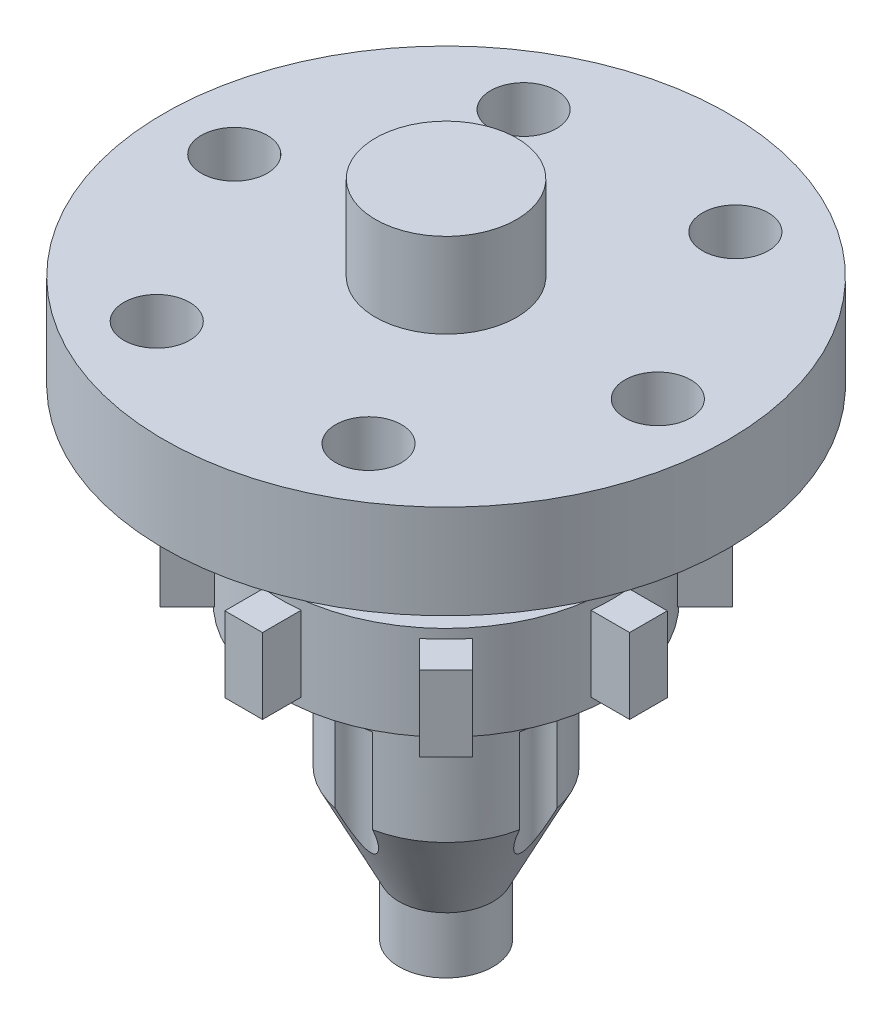
from build123d import *

# Parameters (mm, degrees)
HOLE2_START        = 255
HOLE2_OUTLINE_R    = 17.5
HOLE2_DEPTH        = 50
CIRPATTERN1_COUNT  = 6
RIB2_START         = -20
RIB2_DEPTH         = 40
CIRPATTERN2_COUNT  = 8
SKETCH13_R         = 10
CUT_EXTRUDE1_DEPTH = 125
CIRPATTERN3_COUNT  = 4


# Read off the part's stored shape, not the designer's step: Hole2, Rib2
with BuildPart() as part:
    # Sketch1 → Revolve1 (revolve)
    with BuildSketch(Plane.XY):
        Polygon((0, 0), (0, 350), (37.5, 350), (37.5, 305), (150, 305), (150, 255), (60, 255), (60, 205), (87.5, 205), (87.5, 155), (50, 155), (50, 80), (25, 30), (25, 0), align=None)
    revolve(axis=Axis((0, 0, 0), (0, 1, 0)))

    # Hole2 outline → Hole2 (cut)
    with BuildSketch(Plane(origin=(0, 0, 0), x_dir=(1, 0, 0), z_dir=(0, 1, 0)).offset(HOLE2_START)):
        with Locations((112.5, 0)):
            Circle(HOLE2_OUTLINE_R)
    hole2 = extrude(amount=HOLE2_DEPTH, mode=Mode.SUBTRACT)

    # CirPattern1: Hole2 ×6 about axis
    cirpattern1_axis = Axis((0, 0, 0), (0, 1, 0))
    for i in range(1, CIRPATTERN1_COUNT):
        add(hole2.rotate(cirpattern1_axis, i * 360 / CIRPATTERN1_COUNT), mode=Mode.SUBTRACT)

    # Rib2 outline → Rib2 (add)
    with BuildSketch(Plane(origin=(0, 180, 0), x_dir=(-1, 0, 0), z_dir=(0, -1, 0)).offset(RIB2_START)):
        with BuildLine():
            ThreePointArc((-10, 86.926693254), (0, 87.5), (10, 86.926693254))
            Line((10, 86.926693254), (10, 107.5))
            Line((10, 107.5), (-10, 107.5))
            Line((-10, 107.5), (-10, 86.926693254))
        make_face()
    rib2 = extrude(amount=RIB2_DEPTH)

    # CirPattern2: Rib2 ×8 about axis
    cirpattern2_axis = Axis((0, 0, 0), (0, 1, 0))
    for i in range(1, CIRPATTERN2_COUNT):
        add(rib2.rotate(cirpattern2_axis, i * 360 / CIRPATTERN2_COUNT))

    # Sketch13 → Cut-Extrude1 (cut)
    with BuildSketch(Plane.XZ):
        with Locations((0, 50)):
            Circle(SKETCH13_R)
    cut_extrude1 = extrude(amount=-CUT_EXTRUDE1_DEPTH, mode=Mode.SUBTRACT)

    # CirPattern3: Cut-Extrude1 ×4 about axis
    cirpattern3_axis = Axis((0, 0, 0), (0, 1, 0))
    for i in range(1, CIRPATTERN3_COUNT):
        add(cut_extrude1.rotate(cirpattern3_axis, i * 360 / CIRPATTERN3_COUNT), mode=Mode.SUBTRACT)


solid = part.part
